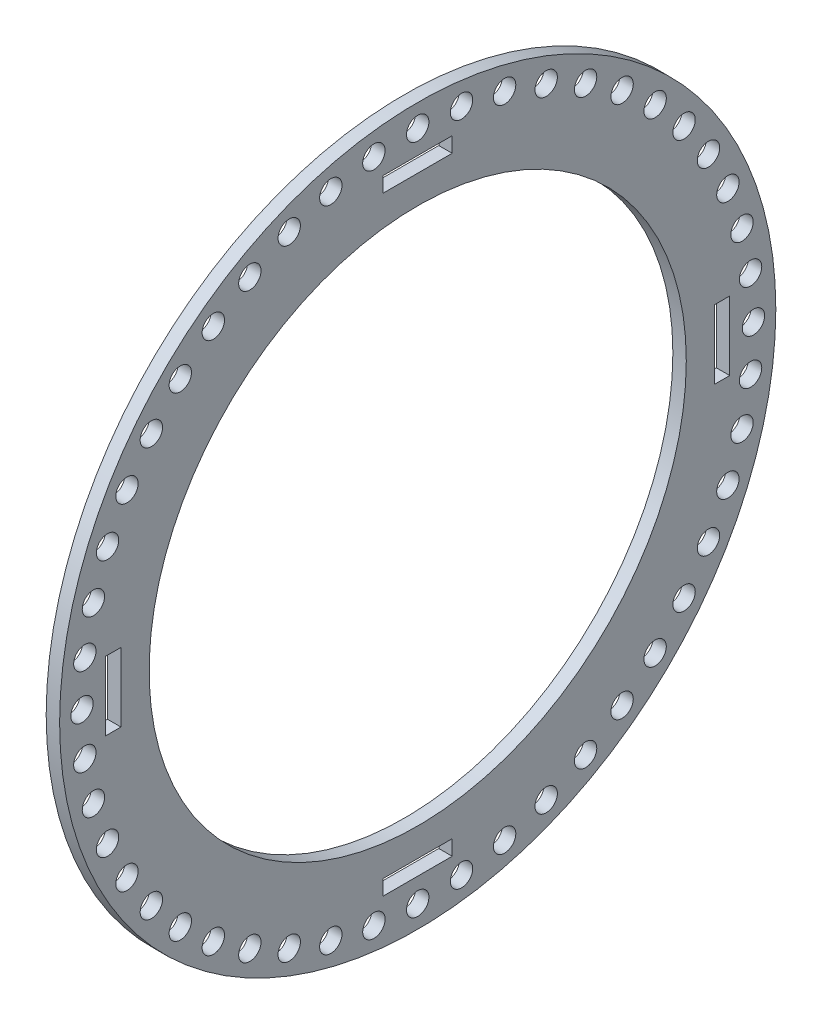
from build123d import *

# Parameters (mm, degrees)
SKETCH1_R           = 40
SKETCH1_R_2         = 30
SKETCH1_W           = 7.7
SKETCH1_H           = 1.7
SKETCH1_W_2         = 1.7
SKETCH1_H_2         = 7.7
BOSS_EXTRUDE4_DEPTH = 1.5
SKETCH2_R           = 1.25
CUT_EXTRUDE2_DEPTH  = 1.5
CIRPATTERN3_COUNT   = 48


with BuildPart() as part:
    # Sketch1 → Boss-Extrude4 (new body)
    with BuildSketch(Plane(origin=(0, 0, 0), x_dir=(0, 0, -1), z_dir=(1, 0, 0))):
        Circle(SKETCH1_R)
        Circle(SKETCH1_R_2, mode=Mode.SUBTRACT)
        with Locations((0, 34)):
            Rectangle(SKETCH1_W, SKETCH1_H, mode=Mode.SUBTRACT)
        with Locations((34, 0)):
            Rectangle(SKETCH1_W_2, SKETCH1_H_2, mode=Mode.SUBTRACT)
        with Locations((0, -34)):
            Rectangle(SKETCH1_W, SKETCH1_H, mode=Mode.SUBTRACT)
        with Locations((-34, 0)):
            Rectangle(SKETCH1_W_2, SKETCH1_H_2, mode=Mode.SUBTRACT)
    extrude(amount=BOSS_EXTRUDE4_DEPTH)

    # Sketch2 → Cut-Extrude2 (cut)
    with BuildSketch(Plane(origin=(1.5, 0, 0), x_dir=(0, 0, -1), z_dir=(1, 0, 0))):
        with Locations((0, 37.5)):
            Circle(SKETCH2_R)
    cut_extrude2 = extrude(amount=-CUT_EXTRUDE2_DEPTH, mode=Mode.SUBTRACT)

    # CirPattern3: Cut-Extrude2 ×48 about axis
    cirpattern3_axis = Axis((1.5, 0, 0), (1, 0, 0))
    for i in range(1, CIRPATTERN3_COUNT):
        add(cut_extrude2.rotate(cirpattern3_axis, i * 360 / CIRPATTERN3_COUNT), mode=Mode.SUBTRACT)


solid = part.part
